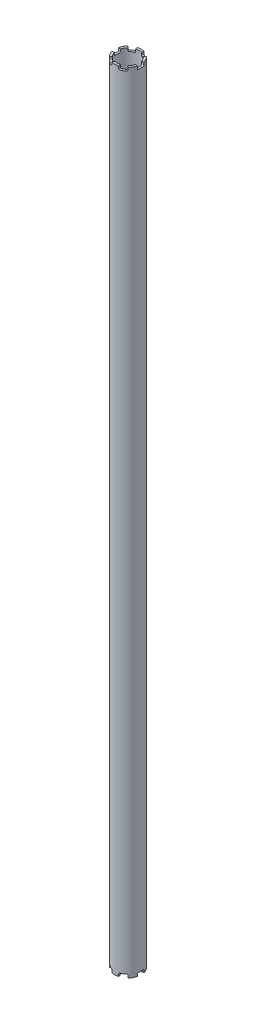
from build123d import *

# Parameters (mm, degrees)
SKETCH1_R            = 30.353
SKETCH1_R_2          = 25.4
BOSS_EXTRUDE1_DEPTH  = 1828.8
CUT_EXTRUDE2_START   = -7.62
CUT_EXTRUDE2_DEPTH   = 7.62
FILLET1_R            = 2.54
FILLET1_OF_MIRROR1_R = 2.54


with BuildPart() as part:
    # Sketch1 → Boss-Extrude1 (new body)
    with BuildSketch(Plane(origin=(0, 0, 0), x_dir=(1, 0, 0), z_dir=(0, 1, 0))):
        Circle(SKETCH1_R)
        Circle(SKETCH1_R_2, mode=Mode.SUBTRACT)
    extrude(amount=BOSS_EXTRUDE1_DEPTH)

    # Sketch2 → Cut-Extrude2 (cut)
    with BuildSketch(Plane(origin=(0, 1828.8, 0), x_dir=(1, 0, 0), z_dir=(0, 1, 0)).offset(CUT_EXTRUDE2_START)):
        with BuildLine():
            Line((24.534515988, 6.574003746), (29.318746605, 7.855934476))
            ThreePointArc((29.318746605, 7.855934476), (30.353, 0), (29.318746605, -7.855934476))
            Line((29.318746605, -7.855934476), (24.534515988, -6.574003746))
            ThreePointArc((24.534515988, -6.574003746), (25.4, 0), (24.534515988, 6.574003746))
        make_face()
        with BuildLine():
            Line((6.574003746, -24.534515988), (7.855934476, -29.318746605))
            ThreePointArc((7.855934476, -29.318746605), (15.1765, -26.286469081), (21.462812129, -21.462812129))
            Line((21.462812129, -21.462812129), (17.960512242, -17.960512242))
            ThreePointArc((17.960512242, -17.960512242), (12.7, -21.997045256), (6.574003746, -24.534515988))
        make_face()
        with BuildLine():
            Line((-17.960512242, -17.960512242), (-21.462812129, -21.462812129))
            ThreePointArc((-21.462812129, -21.462812129), (-15.1765, -26.286469081), (-7.855934476, -29.318746605))
            Line((-7.855934476, -29.318746605), (-6.574003746, -24.534515988))
            ThreePointArc((-6.574003746, -24.534515988), (-12.7, -21.997045256), (-17.960512242, -17.960512242))
        make_face()
        with BuildLine():
            Line((-24.534515988, 6.574003746), (-29.318746605, 7.855934476))
            ThreePointArc((-29.318746605, 7.855934476), (-30.353, 0), (-29.318746605, -7.855934476))
            Line((-29.318746605, -7.855934476), (-24.534515988, -6.574003746))
            ThreePointArc((-24.534515988, -6.574003746), (-25.4, 0), (-24.534515988, 6.574003746))
        make_face()
        with BuildLine():
            Line((-6.574003746, 24.534515988), (-7.855934476, 29.318746605))
            ThreePointArc((-7.855934476, 29.318746605), (-15.1765, 26.286469081), (-21.462812129, 21.462812129))
            Line((-21.462812129, 21.462812129), (-17.960512242, 17.960512242))
            ThreePointArc((-17.960512242, 17.960512242), (-12.7, 21.997045256), (-6.574003746, 24.534515988))
        make_face()
        with BuildLine():
            Line((17.960512242, 17.960512242), (21.462812129, 21.462812129))
            ThreePointArc((21.462812129, 21.462812129), (15.1765, 26.286469081), (7.855934476, 29.318746605))
            Line((7.855934476, 29.318746605), (6.574003746, 24.534515988))
            ThreePointArc((6.574003746, 24.534515988), (12.7, 21.997045256), (17.960512242, 17.960512242))
        make_face()
    cut_extrude2 = extrude(amount=CUT_EXTRUDE2_DEPTH, mode=Mode.SUBTRACT)

    # Fillet1
    fillet1_edges = [part.edges().sort_by_distance(p)[0] for p in [
        (26.926631297, 1821.18, 7.214969111),
        (19.711662186, 1821.18, 19.711662186),
        (-7.214969111, 1821.18, 26.926631297),
        (7.214969111, 1821.18, 26.926631297),
        (26.926631297, 1821.18, -7.214969111),
        (19.711662186, 1821.18, -19.711662186),
        (7.214969111, 1821.18, -26.926631297),
        (-26.926631297, 1821.18, 7.214969111),
        (-26.926631297, 1821.18, -7.214969111),
        (-19.711662186, 1821.18, -19.711662186),
        (-7.214969111, 1821.18, -26.926631297),
        (-19.711662186, 1821.18, 19.711662186),
    ]]
    fillet(fillet1_edges, radius=FILLET1_R)

    # Mirror1: Cut-Extrude2 across plane
    add(cut_extrude2.mirror(Plane(origin=(0, 914.4, 0), x_dir=(0, 0, 1), z_dir=(0, -1, 0))), mode=Mode.SUBTRACT)

    # Fillet1 of Mirror1
    fillet1_of_mirror1_edges = [part.edges().sort_by_distance(p)[0] for p in [
        (26.926631297, 7.62, 7.214969111),
        (19.711662186, 7.62, 19.711662186),
        (-7.214969111, 7.62, 26.926631297),
        (7.214969111, 7.62, 26.926631297),
        (26.926631297, 7.62, -7.214969111),
        (19.711662186, 7.62, -19.711662186),
        (7.214969111, 7.62, -26.926631297),
        (-26.926631297, 7.62, 7.214969111),
        (-26.926631297, 7.62, -7.214969111),
        (-19.711662186, 7.62, -19.711662186),
        (-7.214969111, 7.62, -26.926631297),
        (-19.711662186, 7.62, 19.711662186),
    ]]
    fillet(fillet1_of_mirror1_edges, radius=FILLET1_OF_MIRROR1_R)


solid = part.part
